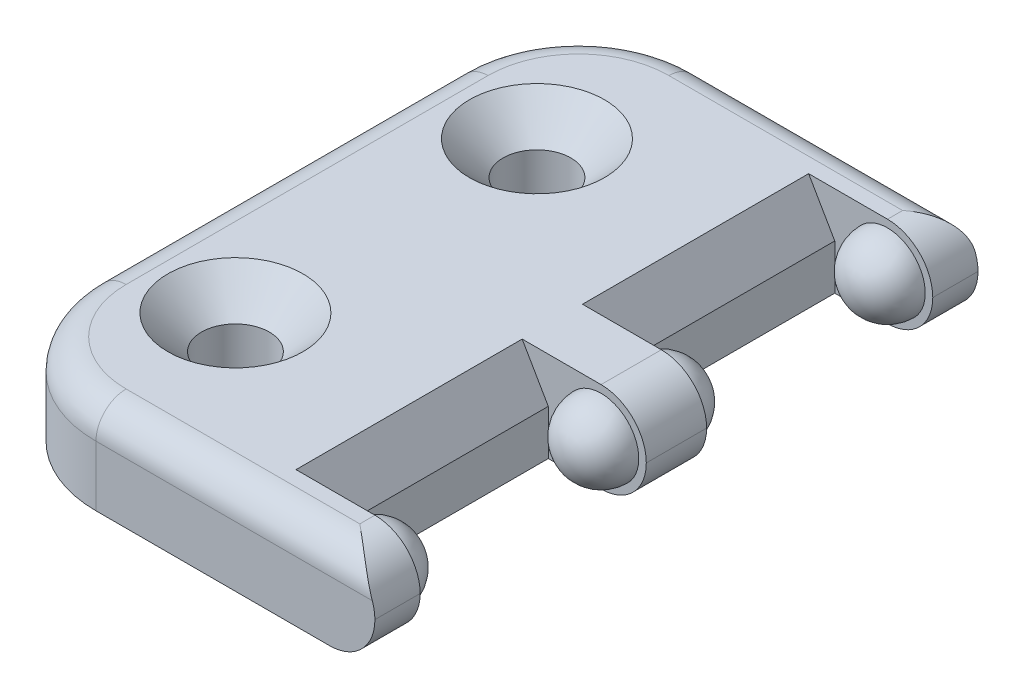
from build123d import *
from OCP.BRepFilletAPI import BRepFilletAPI_MakeChamfer

# Parameters (mm, degrees)
BOSS_EXTRUDE1_DEPTH           = 6
FILLET1_R                     = 3
LPATTERN1_COUNT               = 2
LPATTERN1_PITCH               = 19
CSK_FOR_M4_SFHCS1_D           = 4.5
CSK_FOR_M4_SFHCS1_CSINK_D     = 8.96
CSK_FOR_M4_SFHCS1_CSINK_ANGLE = 90
FILLET2_R                     = 8
FILLET3_R                     = 2
CHAMFER1_SIZE                 = 3
CHAMFER1_SIZE2                = 1.732050808


# Some blends are built 0.0001 mm under size
with BuildPart() as part:
    # Sketch1 → Boss-Extrude1 (new body)
    with BuildSketch(Plane(origin=(0, 0, 0), x_dir=(1, 0, 0), z_dir=(0, 1, 0))):
        Polygon((10, 20), (16.5, 20), (16.5, 17), (10, 17), (10, 2), (16.5, 2), (16.5, -2), (10, -2), (10, -17), (16.5, -17), (16.5, -20), (10, -20), (-10, -20), (-10, 20), align=None)
    extrude(amount=BOSS_EXTRUDE1_DEPTH)

    # Fillet1
    fillet1_edges = [part.edges().sort_by_distance(p)[0] for p in [
        (16.5, 6, -18.5),
        (16.5, 0, -18.5),
        (16.5, 0, 0),
        (16.5, 0, 18.5),
        (16.5, 6, 0),
        (16.5, 6, 18.5),
    ]]
    fillet(fillet1_edges, radius=FILLET1_R - 0.0001)  # a hair under: the kernel refuses the full size

    # Sketch2 → Revolve1 (revolve)
    with BuildSketch(Plane(origin=(13.5, 0, 0), x_dir=(0, 0, -1), z_dir=(1, 0, 0))):
        with BuildLine():
            Line((-2, 3), (-2, 5.5))
            ThreePointArc((-2, 5.5), (-3.767766953, 4.767766953), (-4.5, 3))
            Line((-4.5, 3), (-2, 3))
        make_face()
    revolve1 = revolve(axis=Axis((13.5, 3, 2), (0, 0, 1)))

    # LPattern1: Revolve1 ×2
    with Locations(*[(0, 0, -i * LPATTERN1_PITCH) for i in range(1, LPATTERN1_COUNT)]):
        add(revolve1)

    # Mirror1: Revolve1 across plane
    add(revolve1.mirror(Plane.XY))

    # Mirror1 copy 1 sketch → Mirror1 copy 1 (revolve)
    with BuildSketch(Plane(origin=(13.5, 0, 19), x_dir=(0, 0, 1), z_dir=(1, 0, 0))):
        with BuildLine():
            Line((-2, -3), (-2, -5.5))
            ThreePointArc((-2, -5.5), (-3.767766953, -4.767766953), (-4.5, -3))
            Line((-4.5, -3), (-2, -3))
        make_face()
    revolve(axis=Axis((13.5, 3, 17), (0, 0, 1)))

    # CSK for M4 SFHCS1 (through all)
    with Locations(Plane(origin=(-2.75, 6, -10), x_dir=(0, 0, 1), z_dir=(0, 1, 0))):
        with Locations((0, 0), (20, 0)):
            CounterSinkHole(CSK_FOR_M4_SFHCS1_D / 2, CSK_FOR_M4_SFHCS1_CSINK_D / 2, counter_sink_angle=CSK_FOR_M4_SFHCS1_CSINK_ANGLE)

    # Fillet2
    fillet2_edges = [part.edges().sort_by_distance(p)[0] for p in [
        (-10, 3, -20),
        (-10, 3, 20),
    ]]
    fillet(fillet2_edges, radius=FILLET2_R)

    # Fillet3
    # the kernel refuses this fillet: 2 mm, written as the material it takes off along each edge
    with BuildSketch(Plane(origin=(18.5001, 6, 20), x_dir=(0, 0, -1), z_dir=(-1, 0, 0))) as fillet3_piece_1:
        with BuildLine():
            CenterArc((FILLET3_R, FILLET3_R), FILLET3_R, 180, 90)
            Line((0, FILLET3_R), (0, 0))
            Line((0, 0), (FILLET3_R, 0))
        make_face()
    extrude(amount=20.5001, mode=Mode.SUBTRACT)
    with BuildSketch(Plane(origin=(-2, 6, 12), x_dir=(-1, 0, 0), z_dir=(0, 0, -1))) as fillet3_piece_2:
        with BuildLine():
            CenterArc((8 - FILLET3_R, -FILLET3_R), FILLET3_R, 0, 90)
            Line((8, -FILLET3_R), (8, 0))
            Line((8, 0), (8 - FILLET3_R, 0))
        make_face()
    revolve(axis=Axis((-2, 6, 12), (0, 1, 0)), revolution_arc=90, mode=Mode.SUBTRACT)
    with BuildSketch(Plane(origin=(-2, 6, -12), x_dir=(0, 0, -1), z_dir=(1, 0, 0))) as fillet3_piece_3:
        with BuildLine():
            CenterArc((8 - FILLET3_R, -FILLET3_R), FILLET3_R, 0, 90)
            Line((8 - FILLET3_R, 0), (8, 0))
            Line((8, 0), (8, -FILLET3_R))
        make_face()
    revolve(axis=Axis((-2, 6, -12), (0, 1, 0)), revolution_arc=90, mode=Mode.SUBTRACT)
    with BuildSketch(Plane(origin=(-2, 6, -20), x_dir=(0, -1, 0), z_dir=(1, 0, 0))) as fillet3_piece_4:
        with BuildLine():
            CenterArc((FILLET3_R, -FILLET3_R), FILLET3_R, 90, 90)
            Line((0, -FILLET3_R), (0, 0))
            Line((0, 0), (FILLET3_R, 0))
        make_face()
    extrude(amount=20.5001, mode=Mode.SUBTRACT)
    with BuildSketch(Plane(origin=(-10, 6, 12), x_dir=(1, 0, 0), z_dir=(0, 0, -1))) as fillet3_piece_5:
        with BuildLine():
            CenterArc((FILLET3_R, FILLET3_R), FILLET3_R, 180, 90)
            Line((0, FILLET3_R), (0, 0))
            Line((0, 0), (FILLET3_R, 0))
        make_face()
    extrude(amount=24, mode=Mode.SUBTRACT)

    # Chamfer1: one chamfer whose edges measure the first distance from different faces: ONE call of the kernel's chamfer builder (chamfer() names one face for all edges)
    chamfer1_edges_1 = [part.edges().sort_by_distance(p)[0] for p in [
        (10, 6, 9.5),
    ]]
    chamfer1_side_1 = [part.faces().sort_by_distance(p)[0] for p in [
        (10, 3, 9.5),
    ]]
    chamfer1_edges_2 = [part.edges().sort_by_distance(p)[0] for p in [
        (10, 6, -9.5),
    ]]
    chamfer1_side_2 = [part.faces().sort_by_distance(p)[0] for p in [
        (10, 3, -9.5),
    ]]
    chamfer1 = BRepFilletAPI_MakeChamfer(part.part.solid().wrapped)
    for e in chamfer1_edges_1:
        chamfer1.Add(CHAMFER1_SIZE, CHAMFER1_SIZE2, e.wrapped, chamfer1_side_1[0].wrapped)  # the first distance lies on this face
    for e in chamfer1_edges_2:
        chamfer1.Add(CHAMFER1_SIZE, CHAMFER1_SIZE2, e.wrapped, chamfer1_side_2[0].wrapped)  # the first distance lies on this face
    add(Compound.cast(chamfer1.Shape()), mode=Mode.REPLACE)


solid = part.part
